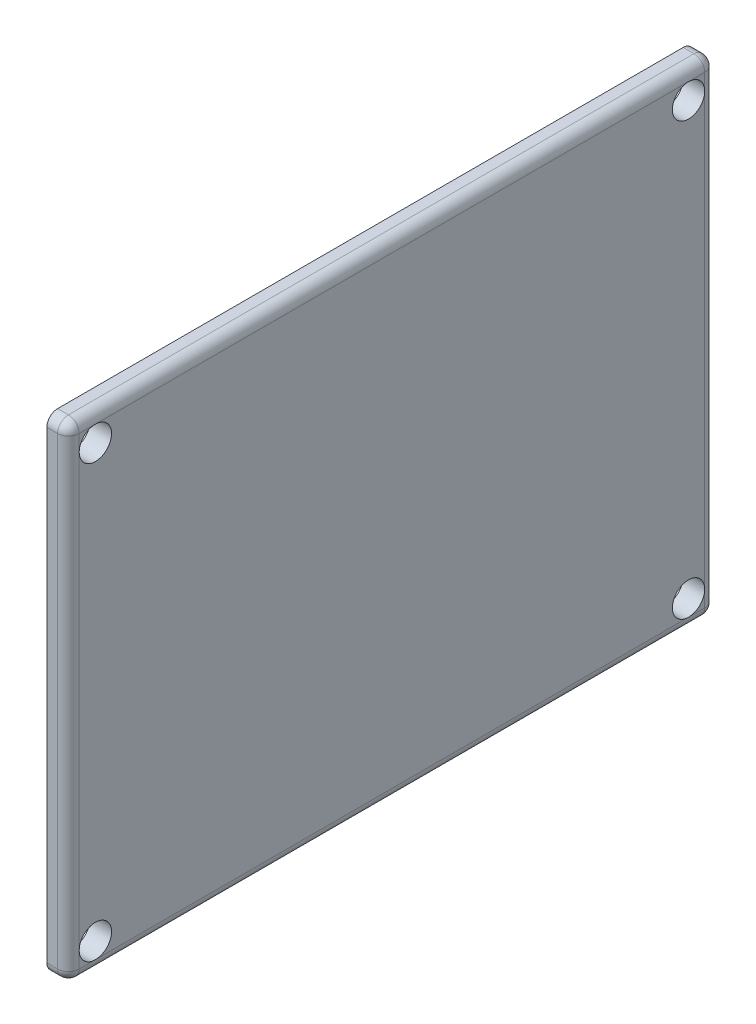
from build123d import *

# Parameters (mm, degrees)
SKETCH1_W                 = 60
SKETCH1_H                 = 45
BOSS_EXTRUDE1_DEPTH       = 2
F_3_0MM_DOWEL_HOLE1_D     = 3
F_3_0MM_DOWEL_HOLE1_DEPTH = 20
F_3_0MM_DOWEL_HOLE1_TIP   = 0.901290929
FILLET2_R                 = 1
FILLET1_R                 = 1


with BuildPart() as part:
    # Sketch1 → Boss-Extrude1 (new body)
    with BuildSketch(Plane(origin=(0, 0, 0), x_dir=(0, 0, -1), z_dir=(1, 0, 0))):
        Rectangle(SKETCH1_W, SKETCH1_H)
    extrude(amount=BOSS_EXTRUDE1_DEPTH)

    # Ø3.0mm Dowel Hole1
    with Locations(Plane(origin=(2, 0, 0), x_dir=(0, 0, -1), z_dir=(1, 0, 0))):
        with Locations((-27.5, 20), (27.5, 20), (27.5, -20), (-27.5, -20)):
            Hole(F_3_0MM_DOWEL_HOLE1_D / 2, depth=F_3_0MM_DOWEL_HOLE1_DEPTH)
            with Locations((0, 0, -(F_3_0MM_DOWEL_HOLE1_DEPTH + F_3_0MM_DOWEL_HOLE1_TIP / 2))):  # 118° drill point
                Cone(0, F_3_0MM_DOWEL_HOLE1_D / 2, F_3_0MM_DOWEL_HOLE1_TIP, mode=Mode.SUBTRACT)

    # Fillet2
    fillet2_edges = [part.edges().sort_by_distance(p)[0] for p in [
        (1, -22.5, -30),
        (1, -22.5, 30),
        (1, 22.5, 30),
        (1, 22.5, -30),
    ]]
    fillet(fillet2_edges, radius=FILLET2_R)

    # Fillet1
    fillet1_edges = [part.edges().sort_by_distance(p)[0] for p in [
        (2, 0, -30),
        (2, -22.5, 0),
        (2, 22.5, 0),
        (2, 0, 30),
        (2, 22.207106781, 29.707106781),
        (2, 22.207106781, -29.707106781),
        (2, -22.207106781, 29.707106781),
        (2, -22.207106781, -29.707106781),
    ]]
    fillet(fillet1_edges, radius=FILLET1_R - 0.0001)  # a hair under: the kernel refuses the full size


solid = part.part
